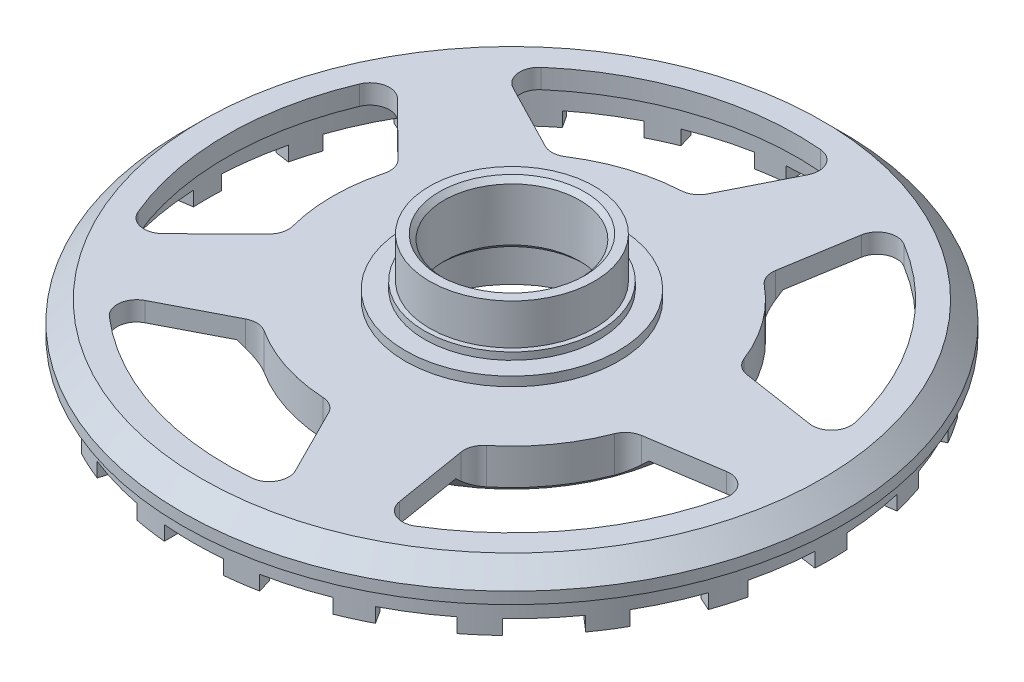
from build123d import *

# Parameters (mm, degrees)
CUT_EXTRUDE2_START      = 20
SKETCH2_W               = 6.1
SKETCH2_H               = 6.762860186
CUT_EXTRUDE2_DEPTH      = 32.033420422
CIRPATTERN1_COUNT       = 22
CUT_EXTRUDE3_START      = 7
SKETCH4_R               = 2.06
CUT_EXTRUDE3_DEPTH      = 3
CIRPATTERN2_COUNT       = 24
SKETCH5_R               = 16.5
SKETCH5_R_2             = 14.5
CUT_EXTRUDE_THIN1_DEPTH = 10
CHAMFER1_SIZE           = 0.5
CUT_EXTRUDE4_DEPTH      = 52.033420422
FILLET1_R               = 2
CIRPATTERN3_START       = 7.499999809
CIRPATTERN3_DEPTH       = 3.700000191


with BuildPart() as part:
    # Sketch1 → Revolve1 (revolve)
    with BuildSketch(Plane.XY, mode=Mode.PRIVATE) as revolve1_sk:
        Polygon((-32.95, 8), (-32.95, 4.5), (-31.45, 4.5), (-31.45, 8.2), (-30.45, 9.2), (-20.2, 9.2), (-18, 7), (-12, 7), (-12, 5.15), (-10.5, 5.15), (-10.5, 10.15), (-9.5, 10.15), (-9.5, 10.65), (-7, 10.65), (-7, 17.1), (-8.5, 17.1), (-8.5, 12.9), (-9, 12.9), (-9, 12.15), (-11, 12.15), (-11, 11.2), (-32, 11.2), (-34, 9.2), (-34, 8.5), (-34, 8), align=None)
    revolve(revolve1_sk.sketch.rotate(Axis((0, 0, 0), (0, -1, 0)), 270), axis=Axis((0, 0, 0), (0, -1, 0)))

    # Sketch2 → Cut-Extrude2 (cut, through all)
    with BuildSketch(Plane.XY.offset(CUT_EXTRUDE2_START)):
        with Locations((0, 2.618569907)):
            Rectangle(SKETCH2_W, SKETCH2_H)
    cut_extrude2 = extrude(amount=CUT_EXTRUDE2_DEPTH, mode=Mode.SUBTRACT)

    # CirPattern1: Cut-Extrude2 ×22 about axis
    cirpattern1_axis = Axis((0, 0, 0), (0, 1, 0))
    for i in range(1, CIRPATTERN1_COUNT):
        add(cut_extrude2.rotate(cirpattern1_axis, i * 360 / CIRPATTERN1_COUNT), mode=Mode.SUBTRACT)

    # Sketch4 → Cut-Extrude3 (cut)
    with BuildSketch(Plane(origin=(0, 0, 0), x_dir=(1, 0, 0), z_dir=(0, 1, 0)).offset(CUT_EXTRUDE3_START)):
        with Locations(Location((-15.5, 0, 0), (0, 0, 90))):
            Circle(SKETCH4_R)
    cut_extrude3 = extrude(amount=CUT_EXTRUDE3_DEPTH, mode=Mode.SUBTRACT)

    # CirPattern2: Cut-Extrude3 ×24 about axis
    cirpattern2_axis = Axis((0, 0, 0), (0, 1, 0))
    for i in range(1, CIRPATTERN2_COUNT):
        add(cut_extrude3.rotate(cirpattern2_axis, i * 360 / CIRPATTERN2_COUNT), mode=Mode.SUBTRACT)

    # Sketch5 → Cut-Extrude-Thin1 (cut)
    with BuildSketch(Plane(origin=(0, 0, 0), x_dir=(1, 0, 0), z_dir=(0, 1, 0))):
        Circle(SKETCH5_R)
        Circle(SKETCH5_R_2, mode=Mode.SUBTRACT)
    extrude(amount=CUT_EXTRUDE_THIN1_DEPTH, mode=Mode.SUBTRACT)

    # Chamfer1
    chamfer1_edges = [part.edges().sort_by_distance(p)[0] for p in [
        (0, 10.65, -7),
        (0, 17.1, -7),
    ]]
    chamfer(chamfer1_edges, length=CHAMFER1_SIZE)

    # Sketch6 → Cut-Extrude4 (cut, through all)
    with BuildSketch(Plane(origin=(0, 0, 0), x_dir=(1, 0, 0), z_dir=(0, 1, 0))):
        with BuildLine():
            Line((-25.88246338, -14.049932007), (-17.560763558, -5.819758008))
            ThreePointArc((-17.560763558, -5.819758008), (-18.5, 0), (-17.560763558, 5.819758008))
            Line((-17.560763558, 5.819758008), (-25.88246338, 14.049932007))
            ThreePointArc((-25.88246338, 14.049932007), (-29.45, 0), (-25.88246338, -14.049932007))
        make_face()
    extrude(amount=CUT_EXTRUDE4_DEPTH, mode=Mode.SUBTRACT)

    # Fillet1
    fillet1_edges = [part.edges().sort_by_distance(p)[0] for p in [
        (-25.88246338, 10.2, 14.049932007),
        (-17.560763558, 9.35, 5.819758008),
        (-17.560763558, 9.35, -5.819758008),
        (-25.88246338, 10.2, -14.049932007),
    ]]
    fillet(fillet1_edges, radius=FILLET1_R)

    # CirPattern3: read off the stored shape, not the designer's step
    # CirPattern3 outline → CirPattern3 (cut)
    with BuildSketch(Plane(origin=(0, 0, 0), x_dir=(1, 0, 0), z_dir=(0, 1, 0)).offset(CIRPATTERN3_START)):
        with BuildLine():
            ThreePointArc((-19.26111391, -22.278060753), (-9.100550484, -28.008614405), (2.487852924, -29.34472845))
            ThreePointArc((2.487852924, -29.34472845), (4.064139029, -28.328676335), (4.105905097, -26.453764235))
            Line((4.105905097, -26.453764235), (0.646327916, -19.570126701))
            ThreePointArc((0.646327916, -19.570126701), (-0.043996264, -18.79573065), (-1.029392897, -18.471338616))
            ThreePointArc((-1.029392897, -18.471338616), (-5.716814396, -17.594545551), (-10.024384081, -15.548688813))
            ThreePointArc((-10.024384081, -15.548688813), (-11.012259557, -15.231925873), (-12.025922128, -15.452663066))
            Line((-12.025922128, -15.452663066), (-18.870879486, -18.988154368))
            ThreePointArc((-18.870879486, -18.988154368), (-19.939135708, -20.529539599), (-19.26111391, -22.278060753))
        make_face()
        with BuildLine():
            ThreePointArc((15.235683321, -25.20270727), (23.825550484, -17.31027568), (28.677284045, -6.701931052))
            ThreePointArc((28.677284045, -6.701931052), (28.198060254, -4.888816509), (26.427819309, -4.269714916))
            Line((26.427819309, -4.269714916), (18.812022834, -5.432807356))
            ThreePointArc((18.812022834, -5.432807356), (17.86220652, -5.850043126), (17.249187056, -6.686968364))
            ThreePointArc((17.249187056, -6.686968364), (14.966814396, -10.874027167), (11.689976776, -14.338564885))
            ThreePointArc((11.689976776, -14.338564885), (11.083447007, -15.180205162), (10.980141592, -16.2124671))
            Line((10.980141592, -16.2124671), (12.227385484, -23.814935295))
            ThreePointArc((12.227385484, -23.814935295), (13.363220625, -25.307221567), (15.235683321, -25.20270727))
        make_face()
        with BuildLine():
            ThreePointArc((28.677284045, 6.701931052), (23.825550484, 17.31027568), (15.235683321, 25.20270727))
            ThreePointArc((15.235683321, 25.20270727), (13.363220625, 25.307221567), (12.227385484, 23.814935295))
            Line((12.227385484, 23.814935295), (10.980141592, 16.2124671))
            ThreePointArc((10.980141592, 16.2124671), (11.083447007, 15.180205162), (11.689976776, 14.338564885))
            ThreePointArc((11.689976776, 14.338564885), (14.966814396, 10.874027167), (17.249187056, 6.686968364))
            ThreePointArc((17.249187056, 6.686968364), (17.86220652, 5.850043126), (18.812022834, 5.432807356))
            Line((18.812022834, 5.432807356), (26.427819309, 4.269714916))
            ThreePointArc((26.427819309, 4.269714916), (28.198060254, 4.888816509), (28.677284045, 6.701931052))
        make_face()
        with BuildLine():
            ThreePointArc((2.487852924, 29.34472845), (-9.100550484, 28.008614405), (-19.26111391, 22.278060753))
            ThreePointArc((-19.26111391, 22.278060753), (-19.939135708, 20.529539599), (-18.870879486, 18.988154368))
            Line((-18.870879486, 18.988154368), (-12.025922128, 15.452663066))
            ThreePointArc((-12.025922128, 15.452663066), (-11.012259557, 15.231925873), (-10.024384081, 15.548688813))
            ThreePointArc((-10.024384081, 15.548688813), (-5.716814396, 17.594545551), (-1.029392897, 18.471338616))
            ThreePointArc((-1.029392897, 18.471338616), (-0.043996264, 18.79573065), (0.646327916, 19.570126701))
            Line((0.646327916, 19.570126701), (4.105905097, 26.453764235))
            ThreePointArc((4.105905097, 26.453764235), (4.064139029, 28.328676335), (2.487852924, 29.34472845))
        make_face()
    extrude(amount=CIRPATTERN3_DEPTH, mode=Mode.SUBTRACT)


solid = part.part
